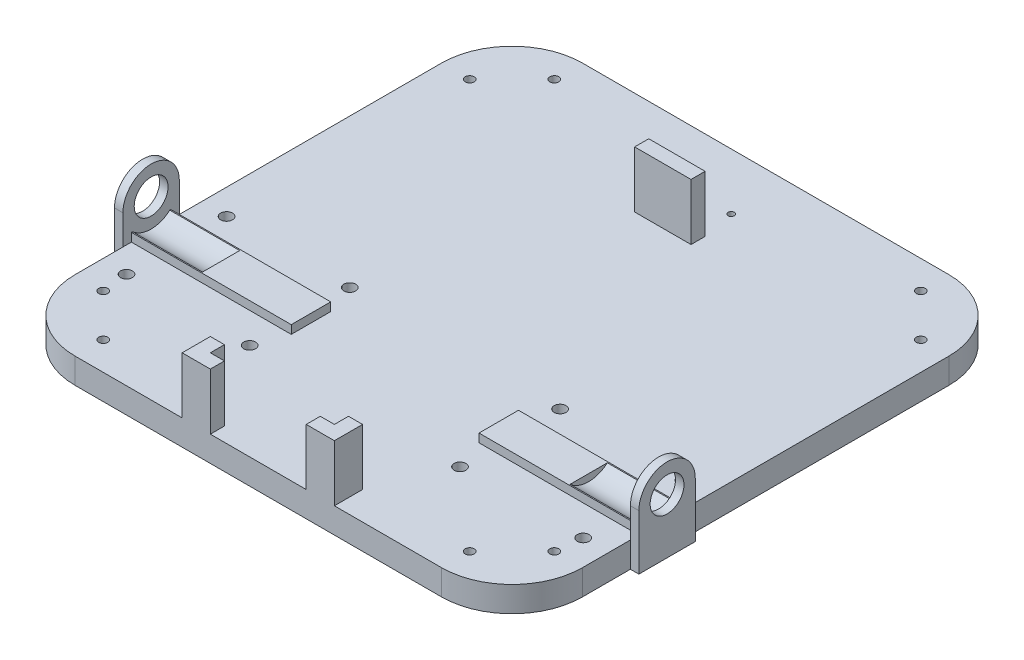
from build123d import *

# Parameters (mm, degrees)
PLATE_DEPTH          = 9
SKETCH2_R            = 1.09
CASTER_HOLES_DEPTH   = 128.597021909
SKETCH3_R            = 1.6
HEX_HOLES_DEPTH      = 128.597021909
SKETCH4_W            = 20
SKETCH4_H            = 5
BATTERY_HOLDER_DEPTH = 20
SKETCH5_W            = 56.7
SKETCH5_H            = 14
BOSS_EXTRUDE2_DEPTH  = 3
SKETCH6_R            = 10
CUT_EXTRUDE1_DEPTH   = 24.8
CUT_EXTRUDE2_START   = -24.8
SKETCH7_R            = 10
CUT_EXTRUDE2_DEPTH   = 24.8
SKETCH8_R            = 6
BOSS_EXTRUDE4_DEPTH  = 3
BOSS_EXTRUDE5_START  = 3
SKETCH9_R            = 6
BOSS_EXTRUDE5_DEPTH  = 3
SKETCH10_R           = 2.1
CLAMP_HOLES_DEPTH    = 132.031484766


with BuildPart() as part:
    # Sketch1 → Plate (new body)
    with BuildSketch(Plane(origin=(0, 0, 0), x_dir=(1, 0, 0), z_dir=(0, 1, 0))):
        with BuildLine():
            Line((-65, -90), (65, -90))
            ThreePointArc((65, -90), (82.67766953, -82.67766953), (90, -65))
            Line((90, -65), (90, 65))
            ThreePointArc((90, 65), (82.67766953, 82.67766953), (65, 90))
            Line((65, 90), (-65, 90))
            ThreePointArc((-65, 90), (-82.67766953, 82.67766953), (-90, 65))
            Line((-90, 65), (-90, -65))
            ThreePointArc((-90, -65), (-82.67766953, -82.67766953), (-65, -90))
        make_face()
    extrude(amount=PLATE_DEPTH)

    # Sketch2 → Caster Holes (cut, through all)
    with BuildSketch(Plane(origin=(0, 9, 0), x_dir=(1, 0, 0), z_dir=(0, 1, 0))):
        with Locations((-7.747, 70)):
            Circle(SKETCH2_R)
        with Locations((7.747, 70)):
            Circle(SKETCH2_R)
    extrude(amount=-CASTER_HOLES_DEPTH, mode=Mode.SUBTRACT)

    # Sketch3 → Hex Holes (cut, through all)
    with BuildSketch(Plane(origin=(0, 9, 0), x_dir=(1, 0, 0), z_dir=(0, 1, 0))):
        with Locations((-65, 80)):
            Circle(SKETCH3_R)
        with Locations((-80, 65)):
            Circle(SKETCH3_R)
        with Locations((80, 65)):
            Circle(SKETCH3_R)
        with Locations((80, -65)):
            Circle(SKETCH3_R)
        with Locations((65, 80)):
            Circle(SKETCH3_R)
        with Locations((65, -80)):
            Circle(SKETCH3_R)
        with Locations((-65, -80)):
            Circle(SKETCH3_R)
        with Locations((-80, -65)):
            Circle(SKETCH3_R)
    extrude(amount=-HEX_HOLES_DEPTH, mode=Mode.SUBTRACT)

    # Sketch4 → Battery Holder (add)
    with BuildSketch(Plane(origin=(0, 9, 0), x_dir=(1, 0, 0), z_dir=(0, 1, 0))):
        Polygon((-27, -90), (-27, -80), (-22, -80), (-22, -85), (-17, -85), (-17, -90), align=None)
        Polygon((17, -90), (17, -85), (22, -85), (22, -80), (27, -80), (27, -90), align=None)
        with Locations((0, 56)):
            Rectangle(SKETCH4_W, SKETCH4_H)
    extrude(amount=BATTERY_HOLDER_DEPTH)

    # Sketch5 → Boss-Extrude2 (add)
    with BuildSketch(Plane(origin=(0, 9, 0), x_dir=(1, 0, 0), z_dir=(0, 1, 0))):
        with Locations((-61.65, -38)):
            Rectangle(SKETCH5_W, SKETCH5_H)
        with Locations((61.65, -38)):
            Rectangle(SKETCH5_W, SKETCH5_H)
    extrude(amount=BOSS_EXTRUDE2_DEPTH)

    # Sketch6 → Cut-Extrude1 (cut)
    with BuildSketch(Plane.ZY.offset(90)):
        with Locations((38, 19.5)):
            Circle(SKETCH6_R)
    extrude(amount=-CUT_EXTRUDE1_DEPTH, mode=Mode.SUBTRACT)

    # Sketch7 → Cut-Extrude2 (cut)
    with BuildSketch(Plane(origin=(90, 0, 0), x_dir=(0, 0, -1), z_dir=(1, 0, 0)).offset(CUT_EXTRUDE2_START)):
        with Locations((-38, 19.5)):
            Circle(SKETCH7_R)
    extrude(amount=CUT_EXTRUDE2_DEPTH, mode=Mode.SUBTRACT)

    # Sketch8 → Boss-Extrude4 (add)
    with BuildSketch(Plane(origin=(90, 0, 0), x_dir=(0, 0, -1), z_dir=(1, 0, 0))):
        with BuildLine():
            Line((-48, 19.5), (-48, 0))
            Line((-48, 0), (-28, 0))
            Line((-28, 0), (-28, 19.5))
            ThreePointArc((-28, 19.5), (-38, 29.5), (-48, 19.5))
        make_face()
        with Locations((-38, 19.5)):
            Circle(SKETCH8_R, mode=Mode.SUBTRACT)
    extrude(amount=BOSS_EXTRUDE4_DEPTH)

    # Sketch9 → Boss-Extrude5 (add)
    with BuildSketch(Plane.ZY.offset(90).offset(BOSS_EXTRUDE5_START)):
        with BuildLine():
            Line((28, 19.5), (28, 0))
            Line((28, 0), (48, 0))
            Line((48, 0), (48, 19.5))
            ThreePointArc((48, 19.5), (38, 29.5), (28, 19.5))
        make_face()
        with Locations((38, 19.5)):
            Circle(SKETCH9_R, mode=Mode.SUBTRACT)
    extrude(amount=-BOSS_EXTRUDE5_DEPTH)

    # Sketch10 → Clamp Holes (cut, through all)
    with BuildSketch(Plane(origin=(0, 9, 0), x_dir=(1, 0, 0), z_dir=(0, 1, 0))):
        with Locations((81, -55.75)):
            Circle(SKETCH10_R)
        with Locations((81, -20.25)):
            Circle(SKETCH10_R)
        with Locations((-81, -20.25)):
            Circle(SKETCH10_R)
        with Locations((-81, -55.75)):
            Circle(SKETCH10_R)
        with Locations((-37.3, -20.25)):
            Circle(SKETCH10_R)
        with Locations((-37.3, -55.75)):
            Circle(SKETCH10_R)
        with Locations((37.3, -55.75)):
            Circle(SKETCH10_R)
        with Locations((37.3, -20.25)):
            Circle(SKETCH10_R)
    extrude(amount=-CLAMP_HOLES_DEPTH, mode=Mode.SUBTRACT)


solid = part.part
